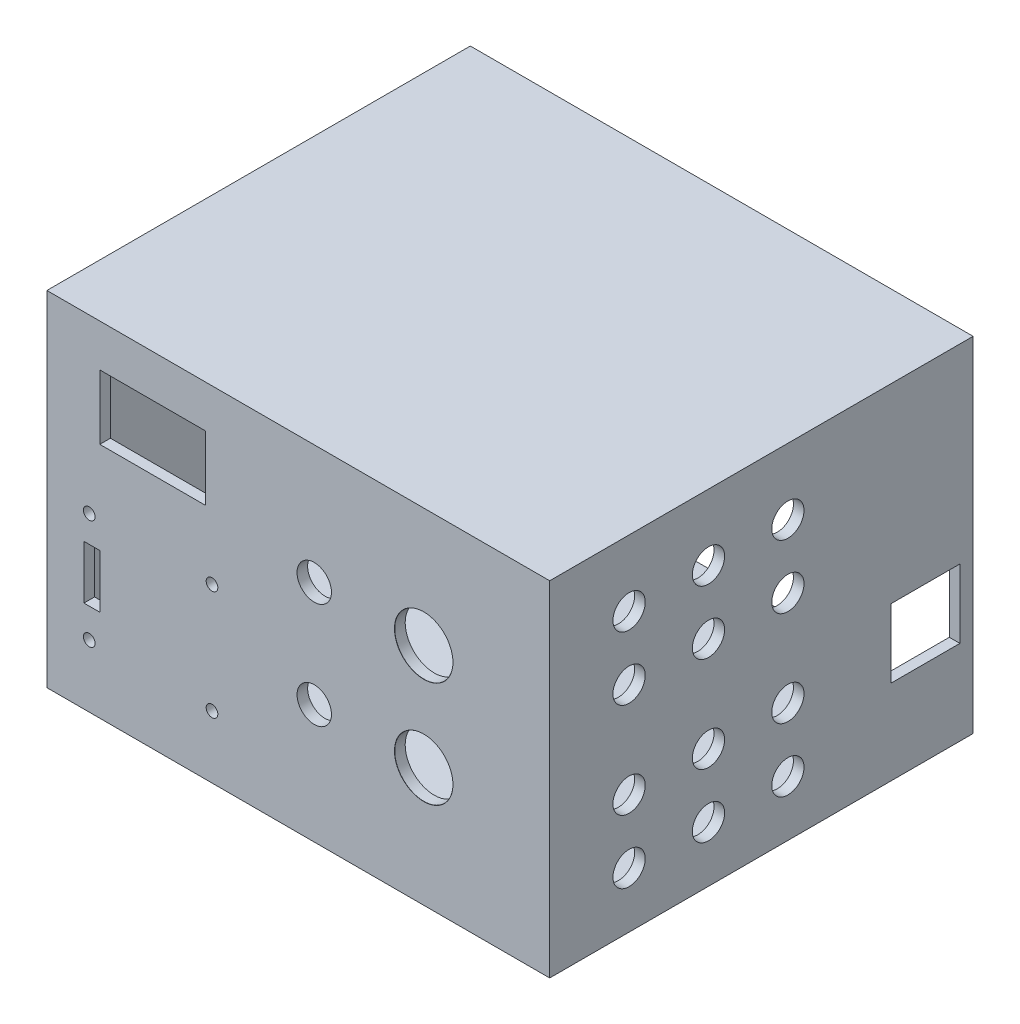
from build123d import *

# Parameters (mm, degrees)
ESQUISSE1_W                  = 95
ESQUISSE1_H                  = 65
BOSS_EXTRU_1_DEPTH           = 83
ENL_V_MAT_EXTRU_3_DEPTH      = 30.5
ENL_V_MAT_EXTRU_3_DEPTH_BACK = 30.5
ESQUISSE4_W                  = 91
ESQUISSE4_H                  = 79
ESQUISSE2_R                  = 1.1
ESQUISSE2_R_2                = 3.25
ESQUISSE2_W                  = 20
ESQUISSE2_H                  = 12.18
ESQUISSE2_W_2                = 3
ESQUISSE2_H_2                = 10.1
ENL_V_MAT_EXTRU_1_DEPTH      = 10
ESQUISSE5_R                  = 3.05
ENL_V_MAT_EXTRU_4_DEPTH      = 10
ESQUISSE6_W                  = 13
ESQUISSE6_H                  = 13
ENL_V_MAT_EXTRU_6_DEPTH      = 10
R_P_TITION_LIN_AIRE1_COUNT   = 2
R_P_TITION_LIN_AIRE1_PITCH   = 20
ENL_V_MAT_EXTRU_7_REACH      = 132.27
ESQUISSE9_W                  = 3
ESQUISSE9_H                  = 65
BOSS_EXTRU_2_DEPTH           = 16
ESQUISSE11_R                 = 2
ENL_V_MAT_EXTRU_8_DEPTH      = 4
CHANFREIN5_SIZE              = 10
CHANFREIN6_SIZE              = 10
CHANFREIN7_SIZE              = 10
CHANFREIN8_SIZE              = 10


with BuildPart() as part:
    # Esquisse1 → Boss.-Extru.1 (new body)
    with BuildSketch(Plane.XY):
        Rectangle(ESQUISSE1_W, ESQUISSE1_H)
    extrude(amount=BOSS_EXTRU_1_DEPTH)

    # Esquisse4 → Enlèv. mat.-Extru.3 (cut, two sides: drawn at the far end of the back side and taken through both)
    with BuildSketch(Plane(origin=(0, 0, 0), x_dir=(1, 0, 0), z_dir=(0, 1, 0)).offset(-ENL_V_MAT_EXTRU_3_DEPTH_BACK)):
        with Locations((0, -41.5)):
            Rectangle(ESQUISSE4_W, ESQUISSE4_H)
    extrude(amount=ENL_V_MAT_EXTRU_3_DEPTH + ENL_V_MAT_EXTRU_3_DEPTH_BACK, mode=Mode.SUBTRACT)

    # Esquisse2 → Enlèv. mat.-Extru.1 (cut)
    with BuildSketch(Plane.XY.offset(83)):
        with Locations((-39.5, 0)):
            Circle(ESQUISSE2_R)
        with Locations((-39.5, -20.7)):
            Circle(ESQUISSE2_R)
        with Locations((-16.30439307, 0)):
            Circle(ESQUISSE2_R)
        with Locations((-16.30439307, -20.7)):
            Circle(ESQUISSE2_R)
        with Locations((3.01560693, 10)):
            Circle(ESQUISSE2_R_2)
        with Locations((3.01560693, -10)):
            Circle(ESQUISSE2_R_2)
        with Locations((-27.5, 18.41)):
            Rectangle(ESQUISSE2_W, ESQUISSE2_H)
        with Locations((-39, -10.1)):
            Rectangle(ESQUISSE2_W_2, ESQUISSE2_H_2)
    extrude(amount=-ENL_V_MAT_EXTRU_1_DEPTH, mode=Mode.SUBTRACT)

    # Esquisse5 → Enlèv. mat.-Extru.4 (cut)
    with BuildSketch(Plane(origin=(47.5, 0, 0), x_dir=(0, 0, -1), z_dir=(1, 0, 0))):
        with Locations((-68, -22)):
            Circle(ESQUISSE5_R)
        with Locations((-68, -10)):
            Circle(ESQUISSE5_R)
        with Locations((-53, -22)):
            Circle(ESQUISSE5_R)
        with Locations((-53, -10)):
            Circle(ESQUISSE5_R)
        with Locations((-38, -22)):
            Circle(ESQUISSE5_R)
        with Locations((-38, -10)):
            Circle(ESQUISSE5_R)
        with Locations((-68, 8)):
            Circle(ESQUISSE5_R)
        with Locations((-68, 20)):
            Circle(ESQUISSE5_R)
        with Locations((-53, 20)):
            Circle(ESQUISSE5_R)
        with Locations((-53, 8)):
            Circle(ESQUISSE5_R)
        with Locations((-38, 20)):
            Circle(ESQUISSE5_R)
        with Locations((-38, 8)):
            Circle(ESQUISSE5_R)
    extrude(amount=-ENL_V_MAT_EXTRU_4_DEPTH, mode=Mode.SUBTRACT)

    # Esquisse6 → Enlèv. mat.-Extru.6 (cut)
    with BuildSketch(Plane(origin=(47.5, 0, 0), x_dir=(0, 0, -1), z_dir=(1, 0, 0))):
        with Locations((-12, -10)):
            Rectangle(ESQUISSE6_W, ESQUISSE6_H)
    extrude(amount=-ENL_V_MAT_EXTRU_6_DEPTH, mode=Mode.SUBTRACT)

    # Esquisse8 → Dégagement M101 (revolve, cut)
    with BuildSketch(Plane(origin=(23.69560693, 10, 83), x_dir=(0, -1, 0), z_dir=(1, 0, 0))):
        Polygon((0, 0), (0, 21.474733405), (5.5, 18.17), (5.5, 0.025), (5.525, 0), align=None)
    d_gagement_m101 = revolve(axis=Axis((23.69560693, 10, 89.35), (0, 0, -1)), mode=Mode.SUBTRACT)

    # Répétition linéaire1: Dégagement M101 ×2
    with Locations(*[(0, -i * R_P_TITION_LIN_AIRE1_PITCH, 0) for i in range(1, R_P_TITION_LIN_AIRE1_COUNT)]):
        add(d_gagement_m101, mode=Mode.SUBTRACT)

    # Esquisse9 → Enlèv. mat.-Extru.7 (cut, up to next)
    with BuildSketch(Plane(origin=(47.5, 0, 0), x_dir=(0, 0, -1), z_dir=(1, 0, 0)), mode=Mode.PRIVATE) as enl_v_mat_extru_7_sk1:
        with Locations((-1.5, 0)):
            Rectangle(ESQUISSE9_W, ESQUISSE9_H)
    enl_v_mat_extru_7_tool1 = extrude(enl_v_mat_extru_7_sk1.sketch, amount=-ENL_V_MAT_EXTRU_7_REACH, mode=Mode.PRIVATE) & part.part
    add(enl_v_mat_extru_7_tool1.solids().sort_by_distance((47.5, 0, 1.5))[0], mode=Mode.SUBTRACT)

    # Esquisse10 → Boss.-Extru.2 (add)
    with BuildSketch(Plane(origin=(0, 0, 3), x_dir=(-1, 0, 0), z_dir=(0, 0, -1))):
        Polygon((-45.5, 16.5), (-31.5, 30.5), (-45.5, 30.5), align=None)
        Polygon((45.5, 16.5), (31.5, 30.5), (45.5, 30.5), align=None)
        Polygon((45.5, -16.5), (31.5, -30.5), (45.5, -30.5), align=None)
        Polygon((-45.5, -16.5), (-31.5, -30.5), (-45.5, -30.5), align=None)
    extrude(amount=-BOSS_EXTRU_2_DEPTH)

    # Esquisse11 → Enlèv. mat.-Extru.8 (cut)
    with BuildSketch(Plane(origin=(0, 0, 3), x_dir=(-1, 0, 0), z_dir=(0, 0, -1))):
        with Locations(Location((-41.5, 26.5, 0), (0, 0, 90))):
            Circle(ESQUISSE11_R)
        with Locations(Location((41.5, 26.5, 0), (0, 0, 270))):
            Circle(ESQUISSE11_R)
        with Locations(Location((-41.5, -26.5, 0), (0, 0, 270))):
            Circle(ESQUISSE11_R)
        with Locations(Location((41.5, -26.5, 0), (0, 0, 90))):
            Circle(ESQUISSE11_R)
    extrude(amount=-ENL_V_MAT_EXTRU_8_DEPTH, mode=Mode.SUBTRACT)

    # Chanfrein5
    # the kernel refuses this chamfer: 10 mm, written as the material it takes off along each edge
    with BuildSketch(Plane(origin=(63.684544799, -1.684544799, 19), x_dir=(-0.019442520806014222, -0.019442520806014142, -0.9996219169112968), z_dir=(-0.7071067811865474, 0.7071067811865478, 0))) as chanfrein5_piece_1_section:
        Polygon((CHANFREIN5_SIZE * 0.999621916911, -CHANFREIN5_SIZE * 0.0274958766106), (-CHANFREIN5_SIZE * 0.0274958766106, -CHANFREIN5_SIZE * 0.999621916911), (0, 0), align=None)
    chanfrein5_piece_1 = extrude(amount=71.232649633, mode=Mode.PRIVATE)
    chanfrein5_piece_1 = split(chanfrein5_piece_1, bisect_by=Plane(origin=(45.5, 25.258750221, 15.243624208), z_dir=(-1, 0, 0)), keep=Keep.TOP, mode=Mode.PRIVATE)
    chanfrein5_piece_1 = split(chanfrein5_piece_1, bisect_by=Plane(origin=(40.258750221, 30.5, 15.243624208), z_dir=(0, -1, 0)), keep=Keep.TOP, mode=Mode.PRIVATE)
    add(chanfrein5_piece_1, mode=Mode.SUBTRACT)

    # Chanfrein6
    # the kernel refuses this chamfer: 10 mm, written as the material it takes off along each edge
    with BuildSketch(Plane(origin=(-63.684544799, 1.684544799, 19), x_dir=(0.019442520806014323, 0.01944252080601439, -0.9996219169112968), z_dir=(0.7071067811865476, -0.7071067811865476, 0))) as chanfrein6_piece_1_section:
        Polygon((CHANFREIN6_SIZE * 0.999621916911, -CHANFREIN6_SIZE * 0.0274958766106), (-CHANFREIN6_SIZE * 0.0274958766106, -CHANFREIN6_SIZE * 0.999621916911), (0, 0), align=None)
    chanfrein6_piece_1 = extrude(amount=71.232649633, mode=Mode.PRIVATE)
    chanfrein6_piece_1 = split(chanfrein6_piece_1, bisect_by=Plane(origin=(-45.5, -25.258750221, 15.243624208), z_dir=(1, 0, 0)), keep=Keep.TOP, mode=Mode.PRIVATE)
    chanfrein6_piece_1 = split(chanfrein6_piece_1, bisect_by=Plane(origin=(-40.258750221, -30.5, 15.243624208), z_dir=(0, 1, 0)), keep=Keep.TOP, mode=Mode.PRIVATE)
    add(chanfrein6_piece_1, mode=Mode.SUBTRACT)

    # Chanfrein7
    # the kernel refuses this chamfer: 10 mm, written as the material it takes off along each edge
    with BuildSketch(Plane(origin=(63.684544799, 1.684544799, 19), x_dir=(0.7068394360706736, -0.7068394360706736, 0.02749587661058597), z_dir=(-0.7071067811865476, -0.7071067811865476, 0))) as chanfrein7_piece_1_section:
        Polygon((CHANFREIN7_SIZE * 0.999621916911, -CHANFREIN7_SIZE * 0.0274958766106), (-CHANFREIN7_SIZE * 0.0274958766106, -CHANFREIN7_SIZE * 0.999621916911), (0, 0), align=None)
    chanfrein7_piece_1 = extrude(amount=71.232649633, mode=Mode.PRIVATE)
    chanfrein7_piece_1 = split(chanfrein7_piece_1, bisect_by=Plane(origin=(40.831369683, -30.5, 18.750065142), z_dir=(0, 1, 0)), keep=Keep.TOP, mode=Mode.PRIVATE)
    chanfrein7_piece_1 = split(chanfrein7_piece_1, bisect_by=Plane(origin=(45.5, -25.831369683, 18.750065142), z_dir=(-1, 0, 0)), keep=Keep.TOP, mode=Mode.PRIVATE)
    add(chanfrein7_piece_1, mode=Mode.SUBTRACT)

    # Chanfrein8
    # the kernel refuses this chamfer: 10 mm, written as the material it takes off along each edge
    with BuildSketch(Plane(origin=(-63.684544799, -1.684544799, 19), x_dir=(0.019442520806014378, -0.019442520806014312, -0.9996219169112968), z_dir=(0.7071067811865476, 0.7071067811865476, 0))) as chanfrein8_piece_1_section:
        Polygon((CHANFREIN8_SIZE * 0.999621916911, CHANFREIN8_SIZE * 0.0274958766106), (-CHANFREIN8_SIZE * 0.0274958766106, CHANFREIN8_SIZE * 0.999621916911), (0, 0), align=None)
    chanfrein8_piece_1 = extrude(amount=71.232649633, mode=Mode.PRIVATE)
    chanfrein8_piece_1 = split(chanfrein8_piece_1, bisect_by=Plane(origin=(-45.5, 25.258750221, 15.243624208), z_dir=(1, 0, 0)), keep=Keep.TOP, mode=Mode.PRIVATE)
    chanfrein8_piece_1 = split(chanfrein8_piece_1, bisect_by=Plane(origin=(-40.258750221, 30.5, 15.243624208), z_dir=(0, -1, 0)), keep=Keep.TOP, mode=Mode.PRIVATE)
    add(chanfrein8_piece_1, mode=Mode.SUBTRACT)


solid = part.part
